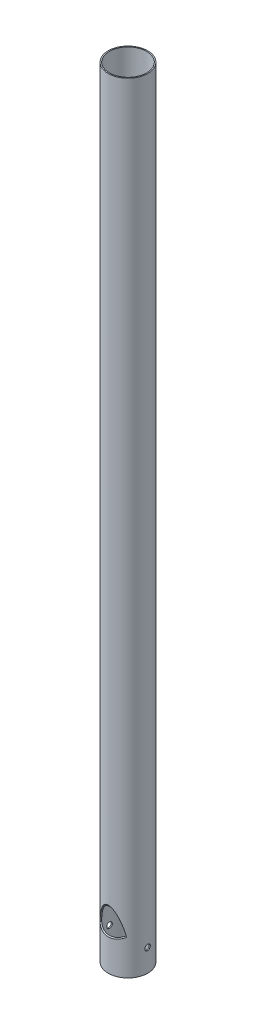
from build123d import *

# Parameters (mm, degrees)
EXTRUDE_1_OUTLINE_R      = 70.5
EXTRUDE_1_OUTLINE_R_2    = 66.5
EXTRUDE_1_DEPTH          = 2780
CUT_EXTRUDE_3_DEPTH      = 2782.787285182
CUT_EXTRUDE_3_DEPTH_BACK = 2782.787285182
SKETCH_6_R               = 10
SKETCH_7_R               = 50
CUT_EXTRUDE_4_DEPTH      = 200
SKETCH_10_R              = 55
CUT_EXTRUDE_5_DEPTH      = 2782.787285287
SKETCH_13_R              = 52.5
CUT_EXTRUDE_8_DEPTH      = 200


# Read off the part's stored shape, not the designer's step: Вытянуть-Тонкостенный1
with BuildPart() as part:
    # Вытянуть-Тонкостенный1 outline → Вытянуть-Тонкостенный1 (new body)
    with BuildSketch(Plane(origin=(0, 0, 0), x_dir=(1, 0, 0), z_dir=(0, 1, 0))):
        Circle(EXTRUDE_1_OUTLINE_R)
        Circle(EXTRUDE_1_OUTLINE_R_2, mode=Mode.SUBTRACT)
    extrude(amount=EXTRUDE_1_DEPTH)

    # Эскиз6 → Вырез-Вытянуть3 (cut, two sides: drawn at the far end of the back side and taken through both)
    with BuildSketch(Plane(origin=(0, 0, 0), x_dir=(0, 0, -1), z_dir=(1, 0, 0)).offset(-CUT_EXTRUDE_3_DEPTH_BACK)):
        with Locations((0, 80)):
            Circle(SKETCH_6_R)
    extrude(amount=CUT_EXTRUDE_3_DEPTH + CUT_EXTRUDE_3_DEPTH_BACK, mode=Mode.SUBTRACT)

    # Эскиз7 → Вырез-Вытянуть4 (cut)
    with BuildSketch(Plane(origin=(0, 272.455155936, 190.775154011), x_dir=(1, 0, 0), z_dir=(0, -0.8191520442889889, -0.5735764363510502))):
        with Locations((0, -13.154034206)):
            Circle(SKETCH_7_R)
    extrude(amount=CUT_EXTRUDE_4_DEPTH, mode=Mode.SUBTRACT)

    # Эскиз10 → Вырез-Вытянуть5 (cut, through all)
    with BuildSketch(Plane.XY):
        with Locations(Location((0, 2630, 0), (0, 0, 90))):
            Circle(SKETCH_10_R)
    extrude(amount=-CUT_EXTRUDE_5_DEPTH, mode=Mode.SUBTRACT)

    # Эскиз13 → Вырез-Вытянуть8 (cut)
    with BuildSketch(Plane(origin=(0, 1533.697054216, 1073.906238692), x_dir=(1, 0, 0), z_dir=(0, -0.8191520442889889, -0.5735764363510502))):
        with Locations((0, -1530.736872885)):
            Circle(SKETCH_13_R)
    extrude(amount=-CUT_EXTRUDE_8_DEPTH, mode=Mode.SUBTRACT)


solid = part.part
